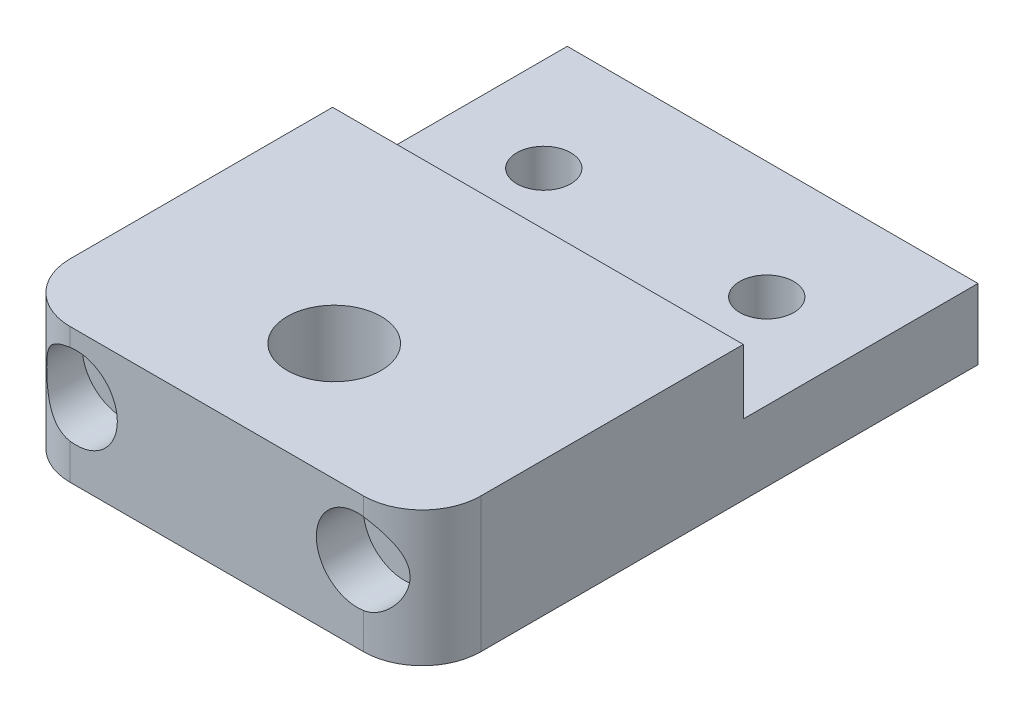
from build123d import *

# Parameters (mm, degrees)
SKETCH1_W                 = 35
SKETCH1_H                 = 27.36
SKETCH1_R                 = 4
BOSS_EXTRUDE1_DEPTH       = 5.5
BOSS_EXTRUDE2_START       = -11.5
BOSS_EXTRUDE2_OUTLINE_W   = 35
BOSS_EXTRUDE2_OUTLINE_H   = 47.36
BOSS_EXTRUDE2_OUTLINE_R   = 4
BOSS_EXTRUDE2_OUTLINE_R_2 = 2.3
BOSS_EXTRUDE2_DEPTH       = 6
FILLET1_R                 = 5
CUT_EXTRUDE1_DEPTH        = 15
CUT_EXTRUDE1_DEPTH_BACK   = 42.689562243
SKETCH4_R                 = 1.4
CUT_EXTRUDE2_START        = -6
SKETCH4_3_R               = 3.5
SKETCH4_3_R_2             = 1.4
CUT_EXTRUDE2_DEPTH        = 15


# Read off the part's stored shape, not the designer's step: Boss-Extrude2
with BuildPart() as part:
    # Sketch1 → Boss-Extrude1 (new body)
    with BuildSketch(Plane(origin=(0, 0, 0), x_dir=(1, 0, 0), z_dir=(0, 1, 0))):
        with Locations((0, 12.715830395)):
            Rectangle(SKETCH1_W, SKETCH1_H)
        with Locations(Location((0, 9.035830395, 0), (0, 0, 270))):
            Circle(SKETCH1_R, mode=Mode.SUBTRACT)
    extrude(amount=BOSS_EXTRUDE1_DEPTH)

    # Boss-Extrude2 outline → Boss-Extrude2 (add)
    with BuildSketch(Plane(origin=(0, 5.5, 0), x_dir=(1, 0, 0), z_dir=(0, 1, 0)).offset(BOSS_EXTRUDE2_START)):
        with Locations((0, 22.715830395)):
            Rectangle(BOSS_EXTRUDE2_OUTLINE_W, BOSS_EXTRUDE2_OUTLINE_H)
        with Locations((0, 9.035830395)):
            Circle(BOSS_EXTRUDE2_OUTLINE_R, mode=Mode.SUBTRACT)
        with Locations((-9.5, 36.395830395)):
            Circle(BOSS_EXTRUDE2_OUTLINE_R_2, mode=Mode.SUBTRACT)
        with Locations((9.5, 36.395830395)):
            Circle(BOSS_EXTRUDE2_OUTLINE_R_2, mode=Mode.SUBTRACT)
    extrude(amount=BOSS_EXTRUDE2_DEPTH)

    # Fillet1
    fillet1_edges = [part.edges().sort_by_distance(p)[0] for p in [
        (17.5, -3, 0.964169605),
        (-17.5, -3, 0.964169605),
    ]]
    fillet(fillet1_edges, radius=FILLET1_R)

    # Sketch4 → Cut-Extrude1 (cut, two sides: drawn at the far end of the back side and taken through both)
    with BuildSketch(Plane(origin=(0, 0, -9.035830395), x_dir=(-1, 0, 0), z_dir=(0, 0, -1)).offset(-CUT_EXTRUDE1_DEPTH_BACK)):
        with Locations((-11.980167066, 0.5)):
            Circle(SKETCH4_R)
        with Locations((11.980167066, 0.5)):
            Circle(SKETCH4_R)
    extrude(amount=CUT_EXTRUDE1_DEPTH + CUT_EXTRUDE1_DEPTH_BACK, mode=Mode.SUBTRACT)

    # Sketch4<3> → Cut-Extrude2 (cut)
    # profile 1 of 2: a face of its own
    with BuildSketch(Plane(origin=(0, 0, -9.035830395), x_dir=(-1, 0, 0), z_dir=(0, 0, -1)).offset(CUT_EXTRUDE2_START)):
        with Locations((-11.980167066, 0.5)):
            Circle(SKETCH4_3_R)
        with Locations((-11.980167066, 0.5)):
            Circle(SKETCH4_3_R_2, mode=Mode.SUBTRACT)
    # profile 2 of 2: a face of its own
    with BuildSketch(Plane(origin=(0, 0, -9.035830395), x_dir=(-1, 0, 0), z_dir=(0, 0, -1)).offset(CUT_EXTRUDE2_START)):
        with Locations((11.980167066, 0.5)):
            Circle(SKETCH4_3_R)
        with Locations((11.980167066, 0.5)):
            Circle(SKETCH4_3_R_2, mode=Mode.SUBTRACT)
    extrude(amount=-CUT_EXTRUDE2_DEPTH, mode=Mode.SUBTRACT)


solid = part.part
